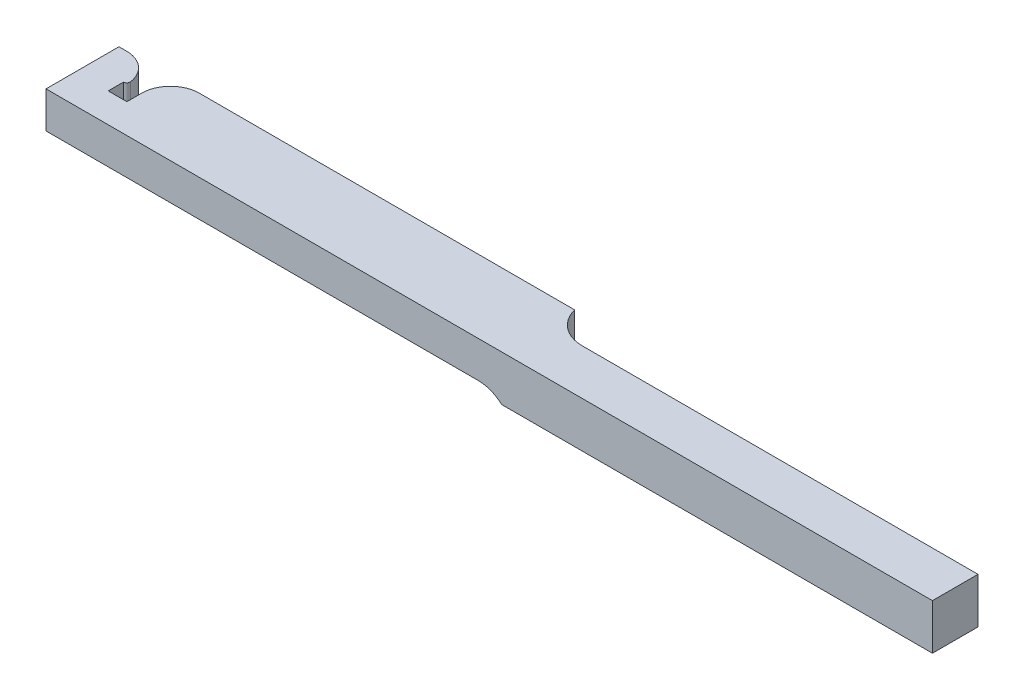
from build123d import *

# Parameters (mm, degrees)
SKETCH1_W           = 10.16
SKETCH1_H           = 5.08
BOSS_EXTRUDE1_DEPTH = 63.5
SKETCH2_W           = 2.1082
SKETCH2_H           = 6.073980388
CUT_EXTRUDE1_DEPTH  = 6
SKETCH3_W           = 0.5
SKETCH3_H           = 2.1082
CUT_EXTRUDE2_DEPTH  = 6
SKETCH4_W           = 6.35
SKETCH4_H           = 6.35
BOSS_EXTRUDE2_DEPTH = 60
FILLET3_R           = 4
FILLET4_R           = 0.5
FILLET6_R           = 5
FILLET10_R          = 5


with BuildPart() as part:
    # Sketch1 → Boss-Extrude1 (new body)
    with BuildSketch(Plane(origin=(0, 0, 0), x_dir=(0, 0, -1), z_dir=(1, 0, 0))):
        with Locations((5.08, 2.54)):
            Rectangle(SKETCH1_W, SKETCH1_H)
    extrude(amount=BOSS_EXTRUDE1_DEPTH)

    # Sketch2 → Cut-Extrude1 (cut)
    with BuildSketch(Plane(origin=(0, 5.08, 0), x_dir=(1, 0, 0), z_dir=(0, 1, 0))):
        with Locations((6.1341, 7.123009806)):
            Rectangle(SKETCH2_W, SKETCH2_H)
    extrude(amount=-CUT_EXTRUDE1_DEPTH, mode=Mode.SUBTRACT)

    # Sketch3 → Cut-Extrude2 (cut)
    with BuildSketch(Plane(origin=(0, 5.08, 0), x_dir=(1, 0, 0), z_dir=(0, 1, 0))):
        with Locations((4.83, 5.140119612)):
            Rectangle(SKETCH3_W, SKETCH3_H)
    extrude(amount=-CUT_EXTRUDE2_DEPTH, mode=Mode.SUBTRACT)

    # Sketch4 → Boss-Extrude2 (add)
    with BuildSketch(Plane(origin=(63.5, 0, 0), x_dir=(0, 0, -1), z_dir=(1, 0, 0))):
        with Locations((3.175, 3.175)):
            Rectangle(SKETCH4_W, SKETCH4_H)
    extrude(amount=BOSS_EXTRUDE2_DEPTH)

    # Fillet3
    # the kernel refuses this fillet: 4 mm, written as the material it takes off along each edge
    with BuildSketch(Plane(origin=(7.1882, 15.08, -10.16), x_dir=(0, 0, 1), z_dir=(0, -1, 0)), Plane(origin=(5.08, 15.08, -10.16), x_dir=(-1, 0, 0), z_dir=(0, -1, 0))) as fillet3_piece_1:
        with BuildLine():
            CenterArc((FILLET3_R, -FILLET3_R), FILLET3_R, 90, 90)
            Line((0, -FILLET3_R), (0, 0))
            Line((0, 0), (FILLET3_R, 0))
        make_face()
    extrude(amount=25.08, mode=Mode.SUBTRACT)

    # Fillet4
    # the kernel refuses this fillet: 0.5 mm, written as the material it takes off along each edge
    with BuildSketch(Plane(origin=(5.079853625, -1.440722871, -6.194219612), x_dir=(-0.08056618488507147, 0, -0.9967492612754044), z_dir=(0, 1, 0))) as fillet4_piece_1:
        with BuildLine():
            CenterArc((0.540271076, 0.498701011), FILLET4_R, 180.054119318, 94.076825667)
            Line((0.0402713, 0.498228731), (0.030271304, 0.498219285))
            ThreePointArc((0.030271304, 0.498219285), (0.010168157, 0.249920027), (-0.009967493, 0.000805662))
            Line((-0.009967493, 0.000805662), (-0.000720361, -0.00997402))
            ThreePointArc((-0.000720361, -0.00997402), (0.288144574, -0.020391911), (0.57700951, -0.00997402))
            Line((0.57700951, -0.00997402), (0.576289148, 0))
        make_face()
    extrude(amount=7.961445741, mode=Mode.SUBTRACT)

    # Fillet6
    # the kernel refuses this fillet: 5 mm, written as the material it adds along each edge
    with BuildSketch(Plane(origin=(63.5, 5.08, -6.35), x_dir=(-1, 0, 0), z_dir=(0, 0, 1))) as fillet6_piece_1:
        with BuildLine():
            CenterArc((3.329729719, -5), FILLET6_R, 90, 41.754936598)
            Line((0, -1.27), (0, 0))
            Line((0, 0), (3.329729719, 0))
        make_face()
    extrude(amount=6.35)

    # Fillet10
    # the kernel refuses this fillet: 5 mm, written as the material it adds along each edge
    with BuildSketch(Plane(origin=(63.5, 0, -6.35), x_dir=(1, 0, 0), z_dir=(0, 1, 0))) as fillet10_piece_1:
        with BuildLine():
            CenterArc((4.856325772, 5), FILLET10_R, 193.768528752, 76.231471248)
            Line((0, 3.81), (-0.097126515, 3.7862))
            ThreePointArc((-0.097126515, 3.7862), (-0.1, 1.905), (-0.1, 0))
            Line((-0.1, 0), (0, -0.1))
            Line((0, -0.1), (4.856325772, -0.1))
            Line((4.856325772, -0.1), (4.856325772, 0))
        make_face()
    extrude(amount=5.08)


with BuildPart() as body_2:
    # Mirror1: mirrored copy
    add(part.part.mirror(Plane(origin=(63.5, 0, 0), x_dir=(0, 0, 1), z_dir=(0, 1, 0))))


solid = body_2.part
